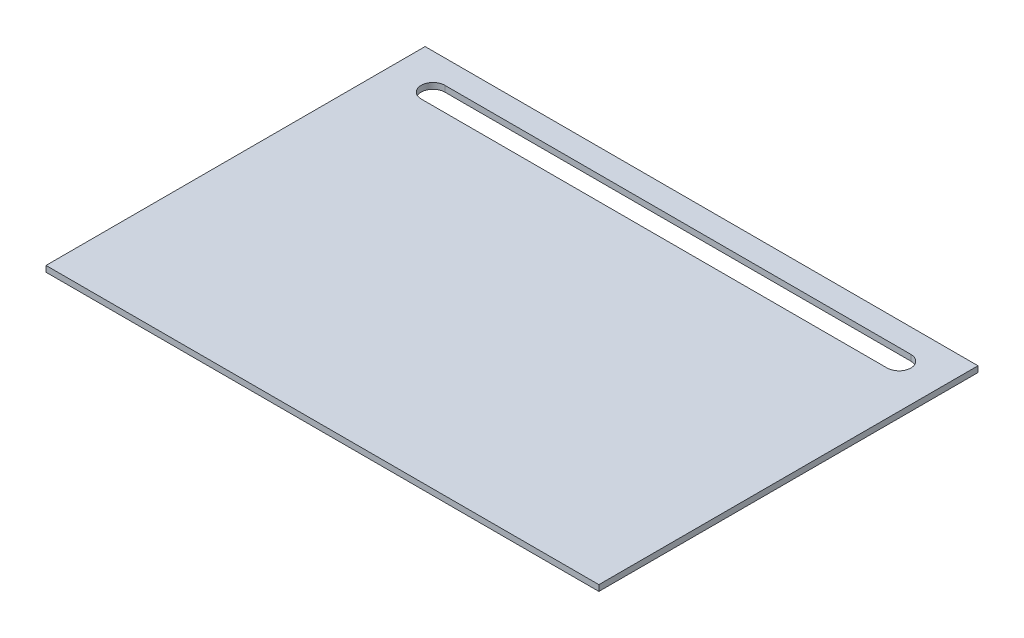
from build123d import *

# Parameters (mm, degrees)
SKETCH1_W           = 558.8
SKETCH1_H           = 304.8
BOSS_EXTRUDE1_DEPTH = 2.38125
SKETCH2_W           = 38.1
SKETCH2_H           = 266.7
CUT_EXTRUDE1_DEPTH  = 319.296719126
SKETCH4_W           = 57.15
SKETCH4_H           = 304.8
CUT_EXTRUDE3_DEPTH  = 319.296719126


with BuildPart() as part:
    # Sketch1 → Boss-Extrude1 (new, symmetric)
    with BuildSketch(Plane(origin=(0, 0, 0), x_dir=(1, 0, 0), z_dir=(0, 1, 0))):
        Rectangle(SKETCH1_W, SKETCH1_H)
    extrude(amount=BOSS_EXTRUDE1_DEPTH, both=True)

    # Sketch2 → Cut-Extrude1 (cut, through all)
    with BuildSketch(Plane(origin=(0, 2.38125, 0), x_dir=(1, 0, 0), z_dir=(0, 1, 0))):
        with Locations((-260.35, 0)):
            Rectangle(SKETCH2_W, SKETCH2_H)
        with Locations((260.35, 0)):
            Rectangle(SKETCH2_W, SKETCH2_H)
    extrude(amount=-CUT_EXTRUDE1_DEPTH, mode=Mode.SUBTRACT)

    # Sketch4 → Cut-Extrude3 (cut, through all)
    with BuildSketch(Plane(origin=(0, 2.38125, 0), x_dir=(1, 0, 0), z_dir=(0, 1, 0))):
        with BuildLine():
            Line((-187.325, 133.35), (187.325, 133.35))
            ThreePointArc((187.325, 133.35), (196.85, 123.825), (187.325, 114.3))
            Line((187.325, 114.3), (-187.325, 114.3))
            ThreePointArc((-187.325, 114.3), (-196.85, 123.825), (-187.325, 133.35))
        make_face()
        with Locations((-250.825, 0)):
            Rectangle(SKETCH4_W, SKETCH4_H)
        with Locations((250.825, 0)):
            Rectangle(SKETCH4_W, SKETCH4_H)
    extrude(amount=-CUT_EXTRUDE3_DEPTH, mode=Mode.SUBTRACT)


solid = part.part
